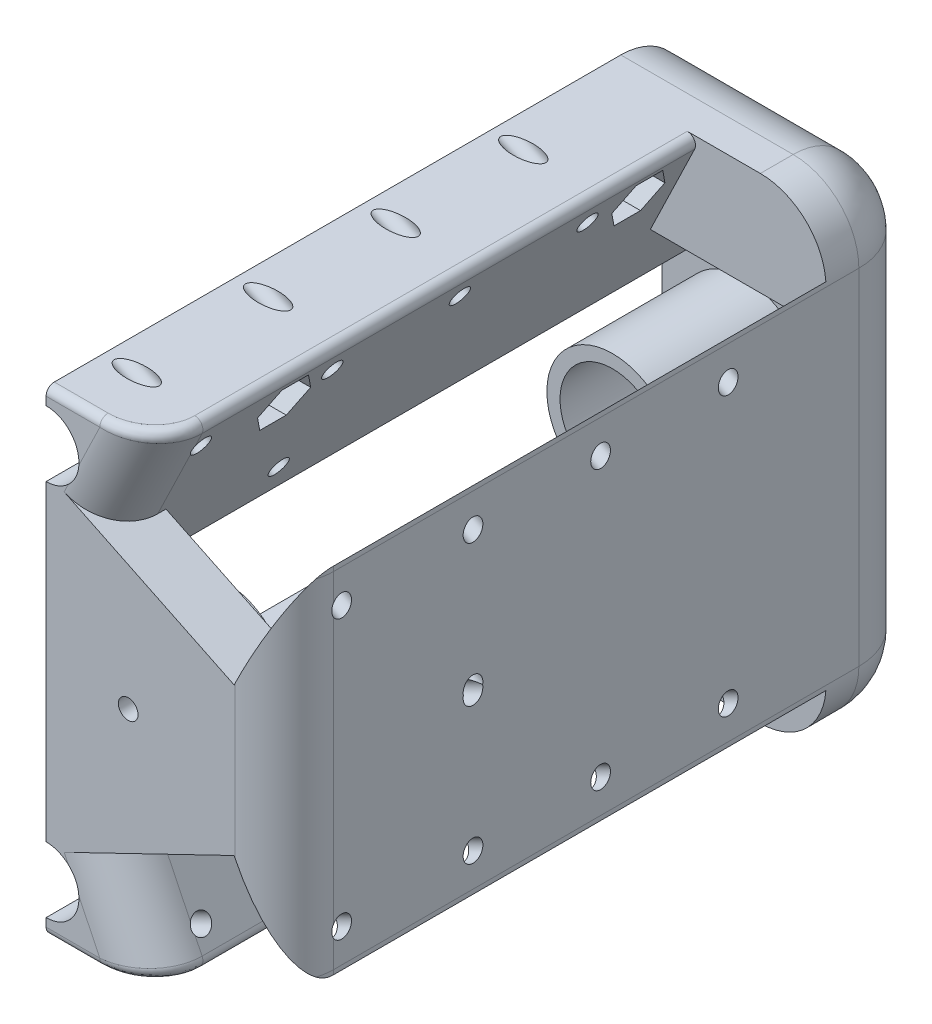
from build123d import *

# Parameters (mm, degrees)
SKETCH_1_W             = 14.5
SKETCH_1_H             = 29
EXTRUDE_1_DEPTH        = 39
CUT_EXTRUDE_772_DEPTH  = 33
SKETCH_3_W             = 36
SKETCH_3_H             = 16.395963738
CUT_EXTRUDE_2_DEPTH    = 12
CUT_EXTRUDE_1501_REACH = 52.717
SKETCH_4_R             = 0.6
EXTRUDE_2_REACH        = 52.717
SKETCH_7_R             = 0.6
CUT_EXTRUDE_2176_DEPTH = 52.181329938
SKETCH_8_R             = 4
SKETCH_8_R_2           = 3.2
EXTRUDE_3_DEPTH        = 8
CUT_EXTRUDE_5_DEPTH    = 50.573178232
SKETCH_11_R            = 3.65
SKETCH_11_R_2          = 3.15
EXTRUDE_4_DEPTH        = 4.5
FILLET_1_R             = 4
FILLET_2_R             = 4
FILLET_3_R             = 3
FILLET_4_R             = 3
EXTRUDE_5_DEPTH        = 2
CUT_EXTRUDE_4956_REACH = 51.83
SKETCH_17_R            = 0.7
CUT_EXTRUDE_9_DEPTH    = 50.829710172
CUT_EXTRUDE_10_REACH   = 52.717
SKETCH_19_R            = 0.6
CUT_EXTRUDE_START      = -0.46
SKETCH_21_R            = 3.15
CUT_EXTRUDE_11_DEPTH   = 0.46
SKETCH_12_R            = 2
CMOS_DEPTH             = 51.717354118
FILLET_5_R             = 0.5


with BuildPart() as part:
    # 草图1 → 凸台-拉伸1 (new body)
    with BuildSketch(Plane.XY):
        with Locations((7.25, -14.5)):
            Rectangle(SKETCH_1_W, SKETCH_1_H)
    extrude(amount=EXTRUDE_1_DEPTH)

    # 草图2 → Cut-Extrude 772 (cut)
    with BuildSketch(Plane.XY.offset(39)):
        Polygon((6.847549412, 0), (3.800490589, -6.302018131), (11.452941176, -10.002018131), (14.5, -3.7), (14.5, 0), align=None)
        Polygon((14.5, -25.3), (11.452941176, -18.997981869), (3.800490589, -22.697981869), (6.847549412, -29), (14.5, -29), align=None)
    extrude(amount=-CUT_EXTRUDE_772_DEPTH, mode=Mode.SUBTRACT)

    # 草图3 → 切除-拉伸2 (cut)
    with BuildSketch(Plane.ZY):
        with Locations((19.5, -14.5)):
            Rectangle(SKETCH_3_W, SKETCH_3_H)
    extrude(amount=-CUT_EXTRUDE_2_DEPTH, mode=Mode.SUBTRACT)

    # 草图4 → Cut-Extrude 1501 (cut, up to next)
    with BuildSketch(Plane.XY.offset(39), mode=Mode.PRIVATE) as cut_extrude_1501_sk1:
        with Locations((5, -14.5)):
            Circle(SKETCH_4_R)
    cut_extrude_1501_tool1 = extrude(cut_extrude_1501_sk1.sketch, amount=-CUT_EXTRUDE_1501_REACH, mode=Mode.PRIVATE) & part.part
    add(cut_extrude_1501_tool1.solids().sort_by_distance((5, -14.5, 39))[0], mode=Mode.SUBTRACT)

    # 草图5 → 凸台-拉伸2 (add, up to next)
    with BuildSketch(Plane.XY.offset(39), mode=Mode.PRIVATE) as extrude_2_sk1:
        Polygon((6.847549412, -29), (3.800490589, -22.697981869), (1.770744335, -18.5), (0, -18.5), (0, -29), align=None)
    extrude_2_tool1 = extrude(extrude_2_sk1.sketch, amount=-EXTRUDE_2_REACH, mode=Mode.PRIVATE) - part.part
    # 草图5 → 凸台-拉伸2 (add, up to next)
    with BuildSketch(Plane.XY.offset(39), mode=Mode.PRIVATE) as extrude_2_sk2:
        Polygon((6.847549412, 0), (3.800490589, -6.302018131), (1.770744335, -10.5), (0, -10.5), (0, 0), align=None)
    extrude_2_tool2 = extrude(extrude_2_sk2.sketch, amount=-EXTRUDE_2_REACH, mode=Mode.PRIVATE) - part.part
    add(extrude_2_tool1.solids().sort_by_distance((2.403791, -24.780878, 39))[0])
    add(extrude_2_tool2.solids().sort_by_distance((2.403791, -4.219122, 39))[0])

    # 草图7 → Cut-Extrude 2176 (cut, symmetric)
    with BuildSketch(Plane(origin=(-5.814746775, -2.811460567, 0), x_dir=(0, 0, -1), z_dir=(0.9002883044568937, 0.4352941176470587, 0))):
        with Locations(Location((-35.5, -26.989058809, 0), (0, 0, 90))):
            Circle(SKETCH_7_R)
        with Locations(Location((-27.5, -26.989058809, 0), (0, 0, 90))):
            Circle(SKETCH_7_R)
        with Locations(Location((-19.73, -26.989058809, 0), (0, 0, 90))):
            Circle(SKETCH_7_R)
        with Locations(Location((-11.96, -26.989058809, 0), (0, 0, 90))):
            Circle(SKETCH_7_R)
        with Locations(Location((-27.5, -19.489058809, 0), (0, 0, 90))):
            Circle(SKETCH_7_R)
    cut_extrude_2176 = extrude(amount=CUT_EXTRUDE_2176_DEPTH, both=True, mode=Mode.SUBTRACT)

    # 镜向1: Cut-Extrude 2176 across plane
    add(cut_extrude_2176.mirror(Plane.ZX.offset(-14.5)), mode=Mode.SUBTRACT)

    # 草图8 → 凸台-拉伸3 (add)
    with BuildSketch(Plane.XY.offset(1.5)):
        with Locations(Location((5, -14.5, 0), (0, 0, 180))):
            Circle(SKETCH_8_R)
        with Locations((5, -14.5)):
            Circle(SKETCH_8_R_2, mode=Mode.SUBTRACT)
    extrude(amount=EXTRUDE_3_DEPTH)

    # 草图9 → 切除-拉伸5 (cut, through all)
    with BuildSketch(Plane.XY.offset(1.5)):
        with BuildLine():
            Line((5.5, -11.339303874), (5.5, -13.085786438))
            ThreePointArc((5.5, -13.085786438), (6.5, -14.5), (5.5, -15.914213562))
            Line((5.5, -15.914213562), (5.5, -17.660696126))
            ThreePointArc((5.5, -17.660696126), (5, -17.7), (4.5, -17.660696126))
            Line((4.5, -17.660696126), (4.5, -15.914213562))
            ThreePointArc((4.5, -15.914213562), (3.5, -14.5), (4.5, -13.085786438))
            Line((4.5, -13.085786438), (4.5, -11.339303874))
            ThreePointArc((4.5, -11.339303874), (5, -11.3), (5.5, -11.339303874))
        make_face()
    extrude(amount=-CUT_EXTRUDE_5_DEPTH, mode=Mode.SUBTRACT)

    # 草图11 → 凸台-拉伸4 (add)
    with BuildSketch(Plane(origin=(0, 0, 37.5), x_dir=(-1, 0, 0), z_dir=(0, 0, -1))):
        with Locations(Location((-5, -14.5, 0), (0, 0, 180))):
            Circle(SKETCH_11_R)
        with Locations((-5, -14.5)):
            Circle(SKETCH_11_R_2, mode=Mode.SUBTRACT)
    extrude(amount=EXTRUDE_4_DEPTH)

    # 圆角1
    fillet_1_edges = [part.edges().sort_by_distance(p)[0] for p in [
        (14.5, 0, 3),
        (14.5, -29, 3),
    ]]
    fillet(fillet_1_edges, radius=FILLET_1_R)

    # 圆角2
    fillet_2_edges = [part.edges().sort_by_distance(p)[0] for p in [
        (5.25, 0, 0),
        (14.5, -14.5, 0),
        (13.328427125, -27.828427125, 0),
        (13.328427125, -1.171572875, 0),
        (5.25, -29, 0),
    ]]
    fillet(fillet_2_edges, radius=FILLET_2_R)

    # 圆角3
    # the kernel refuses this fillet: 3 mm, written as the material it takes off along each edge
    with BuildSketch(Plane(origin=(14.5, -4, 39), x_dir=(-1, 0, 0), z_dir=(0, -1, 0))) as fillet_3_piece_1:
        with BuildLine():
            CenterArc((FILLET_3_R, FILLET_3_R), FILLET_3_R, 180, 90)
            Line((0, FILLET_3_R), (0, 0))
            Line((0, 0), (FILLET_3_R, 0))
        make_face()
    extrude(amount=21, mode=Mode.SUBTRACT)
    with BuildSketch(Plane(origin=(10.5, -25, 39), x_dir=(1, 0, 0), z_dir=(0, 1, 0))) as fillet_3_piece_2:
        with BuildLine():
            CenterArc((4 - FILLET_3_R, FILLET_3_R), FILLET_3_R, 270, 90)
            Line((4, FILLET_3_R), (4, 0))
            Line((4, 0), (4 - FILLET_3_R, 0))
        make_face()
    revolve(axis=Axis((10.5, -25, 39), (0, 0, -1)), revolution_arc=111.439978432, mode=Mode.SUBTRACT)
    with BuildSketch(Plane(origin=(10.5, -4, 39), x_dir=(-0.36552634456727745, 0.9308009945349672, 0), z_dir=(-0.9308009945349672, -0.36552634456727745, 0))) as fillet_3_piece_3:
        with BuildLine():
            CenterArc((4 - FILLET_3_R, FILLET_3_R), FILLET_3_R, 270, 90)
            Line((4 - FILLET_3_R, 0), (4, 0))
            Line((4, 0), (4, FILLET_3_R))
        make_face()
    revolve(axis=Axis((10.5, -4, 39), (0, 0, -1)), revolution_arc=111.439978432, mode=Mode.SUBTRACT)

    # 圆角4
    # the kernel refuses this fillet: 3 mm, written as the material it takes off along each edge
    with BuildSketch(Plane(origin=(0.535784706, -15.945819585, 39), x_dir=(-0.9002883044568939, -0.43529411764705866, 0), z_dir=(0.43529411764705866, -0.9002883044568939, 0))) as fillet_4_piece_1_section:
        with BuildLine():
            CenterArc((FILLET_4_R, FILLET_4_R), FILLET_4_R, 180, 90)
            Line((0, FILLET_4_R), (0, 0))
            Line((0, 0), (FILLET_4_R, 0))
        make_face()
    fillet_4_piece_1 = extrude(amount=22, mode=Mode.PRIVATE)
    fillet_4_piece_1 = split(fillet_4_piece_1, bisect_by=Plane(origin=(2.103294252, -19.353252849, 37.5), z_dir=(0, 0, -1)), keep=Keep.TOP, mode=Mode.PRIVATE)
    fillet_4_piece_1 = split(fillet_4_piece_1, bisect_by=Plane(origin=(3.735647193, -22.729333991, 37.010247646), z_dir=(-0.4352941176470583, 0.900288304456894, 0)), keep=Keep.TOP, mode=Mode.PRIVATE)
    add(fillet_4_piece_1, mode=Mode.SUBTRACT)
    with BuildSketch(Plane(origin=(3.800490589, -22.697981869, 39), x_dir=(-0.9002883044568937, -0.4352941176470586, 0), z_dir=(0.43529411764705866, -0.9002883044568939, 0))) as fillet_4_piece_2_section:
        with BuildLine():
            CenterArc((FILLET_4_R, FILLET_4_R), FILLET_4_R, 180, 90)
            Line((0, FILLET_4_R), (0, 0))
            Line((0, 0), (FILLET_4_R, 0))
        make_face()
    fillet_4_piece_2 = extrude(amount=14.5, mode=Mode.PRIVATE)
    fillet_4_piece_2 = split(fillet_4_piece_2, bisect_by=Plane(origin=(6.267328123, -29.55822886, 37.5), z_dir=(0, 0, 1)), keep=Keep.TOP, mode=Mode.PRIVATE)
    add(fillet_4_piece_2, mode=Mode.SUBTRACT)
    with BuildSketch(Plane(origin=(3.800490589, -22.697981869, 39), x_dir=(-0.9002883044568937, -0.4352941176470586, 0), z_dir=(0.43529411764705866, -0.9002883044568939, 0))) as fillet_4_piece_3_section:
        with BuildLine():
            CenterArc((FILLET_4_R, FILLET_4_R), FILLET_4_R, 180, 90)
            Line((0, FILLET_4_R), (0, 0))
            Line((0, 0), (FILLET_4_R, 0))
        make_face()
    fillet_4_piece_3 = extrude(amount=14.5, mode=Mode.PRIVATE)
    fillet_4_piece_3 = split(fillet_4_piece_3, bisect_by=Plane(origin=(6.891529546, -29.256424198, 37.5), z_dir=(0, 0, -1)), keep=Keep.TOP, mode=Mode.PRIVATE)
    add(fillet_4_piece_3, mode=Mode.SUBTRACT)
    with BuildSketch(Plane(origin=(10.112255294, 6.752162283, 39), x_dir=(0, 0, -1), z_dir=(-0.4352941176470589, -0.9002883044568937, 0))) as fillet_4_piece_4_section:
        with BuildLine():
            CenterArc((FILLET_4_R, -FILLET_4_R), FILLET_4_R, 90, 90)
            Line((0, -FILLET_4_R), (0, 0))
            Line((0, 0), (FILLET_4_R, 0))
        make_face()
    fillet_4_piece_4 = extrude(amount=14.5, mode=Mode.PRIVATE)
    fillet_4_piece_4 = split(fillet_4_piece_4, bisect_by=Plane(origin=(6.891529546, 0.256424198, 37.5), z_dir=(0, 0, -1)), keep=Keep.TOP, mode=Mode.PRIVATE)
    add(fillet_4_piece_4, mode=Mode.SUBTRACT)
    with BuildSketch(Plane(origin=(10.112255294, 6.752162283, 39), x_dir=(0, 0, -1), z_dir=(-0.4352941176470589, -0.9002883044568937, 0))) as fillet_4_piece_5_section:
        with BuildLine():
            CenterArc((FILLET_4_R, -FILLET_4_R), FILLET_4_R, 90, 90)
            Line((0, -FILLET_4_R), (0, 0))
            Line((0, 0), (FILLET_4_R, 0))
        make_face()
    fillet_4_piece_5 = extrude(amount=14.5, mode=Mode.PRIVATE)
    fillet_4_piece_5 = split(fillet_4_piece_5, bisect_by=Plane(origin=(6.267328123, 0.55822886, 37.5), z_dir=(0, 0, 1)), keep=Keep.TOP, mode=Mode.PRIVATE)
    add(fillet_4_piece_5, mode=Mode.SUBTRACT)
    with BuildSketch(Plane(origin=(10.112255294, 6.752162283, 39), x_dir=(0, 0, -1), z_dir=(-0.4352941176470589, -0.9002883044568937, 0))) as fillet_4_piece_6_section:
        with BuildLine():
            CenterArc((FILLET_4_R, -FILLET_4_R), FILLET_4_R, 90, 90)
            Line((0, -FILLET_4_R), (0, 0))
            Line((0, 0), (FILLET_4_R, 0))
        make_face()
    fillet_4_piece_6 = extrude(amount=22, mode=Mode.PRIVATE)
    fillet_4_piece_6 = split(fillet_4_piece_6, bisect_by=Plane(origin=(3.735647193, -6.270666009, 37.010247646), z_dir=(-0.4352941176470586, -0.9002883044568939, 0)), keep=Keep.TOP, mode=Mode.PRIVATE)
    fillet_4_piece_6 = split(fillet_4_piece_6, bisect_by=Plane(origin=(2.103294252, -9.646747151, 37.5), z_dir=(0, 0, -1)), keep=Keep.TOP, mode=Mode.PRIVATE)
    add(fillet_4_piece_6, mode=Mode.SUBTRACT)

    # 草图14 → 凸台-拉伸5 (add)
    with BuildSketch(Plane(origin=(0, 0, 37.5), x_dir=(-1, 0, 0), z_dir=(0, 0, -1))):
        Polygon((-1.324305359, -10.5), (-3.438643302, -6.12706307), (-11.452941176, -10.002018131), (-12, -8.870574722), (-12, -20.129425278), (-11.452941176, -18.997981869), (-3.438643302, -22.87293693), (-1.324305359, -18.5), (0, -18.5), (0, -10.5), align=None)
    extrude(amount=EXTRUDE_5_DEPTH)

    # Cut-Extrude 4956: up to this plane
    cut_extrude_4956_end = Plane(origin=(6.847549412, 0, 6), z_dir=(-0.9002883044568937, 0.4352941176470589, 0))
    # 草图16 → Cut-Extrude 4956 (cut, up to the surface)
    with BuildSketch(Plane.ZY.offset(-3.5), mode=Mode.PRIVATE) as cut_extrude_4956_sk1:
        Polygon((29.383419246, -1), (28.575128869, -2.4), (29.383419246, -3.8), (31, -3.8), (31.808290377, -2.4), (31, -1), align=None)
    cut_extrude_4956_tool1 = split(extrude(cut_extrude_4956_sk1.sketch, amount=-CUT_EXTRUDE_4956_REACH, mode=Mode.PRIVATE), bisect_by=cut_extrude_4956_end, keep=Keep.BOTH, mode=Mode.PRIVATE)
    # 草图16 → Cut-Extrude 4956 (cut, up to the surface)
    with BuildSketch(Plane.ZY.offset(-3.5), mode=Mode.PRIVATE) as cut_extrude_4956_sk2:
        Polygon((9.424871131, -1), (7.808290377, -1), (7, -2.4), (7.808290377, -3.8), (9.424871131, -3.8), (10.233161507, -2.4), align=None)
    cut_extrude_4956_tool2 = split(extrude(cut_extrude_4956_sk2.sketch, amount=-CUT_EXTRUDE_4956_REACH, mode=Mode.PRIVATE), bisect_by=cut_extrude_4956_end, keep=Keep.BOTH, mode=Mode.PRIVATE)
    cut_extrude_4956 = cut_extrude_4956_tool1.solids().sort_by_distance((3.5, -2.4, 30.19171))[0] + cut_extrude_4956_tool2.solids().sort_by_distance((3.5, -2.4, 8.616581))[0]
    add(cut_extrude_4956, mode=Mode.SUBTRACT)

    # 草图17 → 切除-拉伸9 (cut, through all)
    with BuildSketch(Plane(origin=(3.5, 0, 0), x_dir=(0, 0, -1), z_dir=(1, 0, 0))):
        with Locations((-30.191709623, -2.4)):
            Circle(SKETCH_17_R)
        with Locations((-8.616580754, -2.4)):
            Circle(SKETCH_17_R)
    cut_extrude_9 = extrude(amount=-CUT_EXTRUDE_9_DEPTH, mode=Mode.SUBTRACT)

    # 镜向2: Cut-Extrude 4956, 切除-拉伸9 across plane
    add(cut_extrude_4956.mirror(Plane.ZX.offset(-14.5)), mode=Mode.SUBTRACT)
    add(cut_extrude_9.mirror(Plane.ZX.offset(-14.5)), mode=Mode.SUBTRACT)

    # 草图19 → 切除-拉伸10 (cut, up to next)
    with BuildSketch(Plane.XY.offset(39), mode=Mode.PRIVATE) as cut_extrude_10_sk1:
        with Locations((5, -14.5)):
            Circle(SKETCH_19_R)
    cut_extrude_10_tool1 = extrude(cut_extrude_10_sk1.sketch, amount=-CUT_EXTRUDE_10_REACH, mode=Mode.PRIVATE) & part.part
    add(cut_extrude_10_tool1.solids().sort_by_distance((5, -14.5, 39))[0], mode=Mode.SUBTRACT)

    # 草图21 → 切除-拉伸11 (cut)
    with BuildSketch(Plane(origin=(0, 0, 35.5), x_dir=(-1, 0, 0), z_dir=(0, 0, -1)).offset(CUT_EXTRUDE_START)):
        with Locations((-5, -14.5)):
            Circle(SKETCH_21_R)
    extrude(amount=CUT_EXTRUDE_11_DEPTH, mode=Mode.SUBTRACT)

    # 草图12 → CMOS (cut, through all)
    with BuildSketch(Plane.XY.offset(39)):
        with Locations((0, -26)):
            Circle(SKETCH_12_R)
        with Locations((0, -3)):
            Circle(SKETCH_12_R)
    extrude(amount=-CMOS_DEPTH, mode=Mode.SUBTRACT)

    # 圆角5
    fillet_5_edges = [part.edges().sort_by_distance(p)[0] for p in [
        (6.847549412, -29, 21),
        (5.150057109, -29, 38.614172972),
        (6.847549412, 0, 21),
        (5.150057109, 0, 38.614172972),
        (1.757641766, -29, 39),
        (1.757641766, 0, 39),
    ]]
    fillet(fillet_5_edges, radius=FILLET_5_R)


solid = part.part
